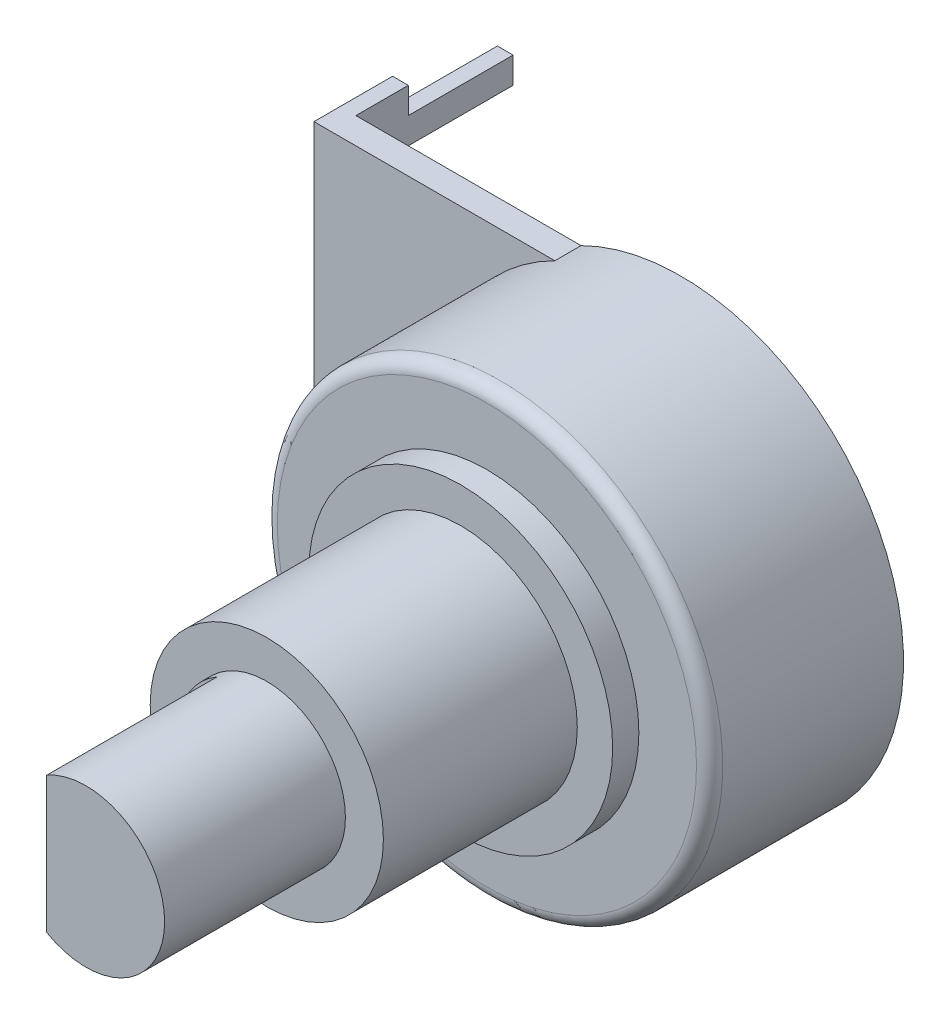
from build123d import *

# Parameters (mm, degrees)
SKETCH_1_R          = 4.45
EXTRUDE_1_DEPTH     = 7.4
SKETCH_2_R          = 3
EXTRUDE_2_DEPTH     = 6.9
SKETCH_3_W          = 3.920658057
SKETCH_3_H          = 6.821702254
CUT_EXTRUDE_1_DEPTH = 6.5
SKETCH_4_R          = 5.8
EXTRUDE_3_DEPTH     = 1
SKETCH_5_R          = 8.5
EXTRUDE_4_DEPTH     = 7.4
FILLET_1_R          = 0.5
SKETCH_6_W          = 13
SKETCH_6_H          = 15.2
EXTRUDE_5_DEPTH     = 1
SKETCH_7_W          = 0.6
SKETCH_7_H          = 3
EXTRUDE_6_DEPTH     = 6
SKETCH_8_W          = 4
SKETCH_8_H          = 1
CUT_EXTRUDE_2_DEPTH = 28.237107042


with BuildPart() as part:
    # Эскиз1 → Бобышка-Вытянуть1 (new body)
    with BuildSketch(Plane.XY):
        Circle(SKETCH_1_R)
    extrude(amount=EXTRUDE_1_DEPTH)

    # Эскиз2 → Бобышка-Вытянуть2 (add)
    with BuildSketch(Plane.XY.offset(7.4)):
        Circle(SKETCH_2_R)
    extrude(amount=EXTRUDE_2_DEPTH)

    # Эскиз3 → Вырез-Вытянуть1 (cut)
    with BuildSketch(Plane.XY.offset(14.3)):
        with Locations((-3.460329029, -0.248834335)):
            Rectangle(SKETCH_3_W, SKETCH_3_H)
    extrude(amount=-CUT_EXTRUDE_1_DEPTH, mode=Mode.SUBTRACT)

    # Эскиз4 → Бобышка-Вытянуть3 (add)
    with BuildSketch(Plane(origin=(0, 0, 0), x_dir=(-1, 0, 0), z_dir=(0, 0, -1))):
        Circle(SKETCH_4_R)
    extrude(amount=EXTRUDE_3_DEPTH)

    # Эскиз5 → Бобышка-Вытянуть4 (add)
    with BuildSketch(Plane(origin=(0, 0, -1), x_dir=(-1, 0, 0), z_dir=(0, 0, -1))):
        Circle(SKETCH_5_R)
    extrude(amount=EXTRUDE_4_DEPTH)

    # Скругление1
    fillet_1_edges = [part.edges().sort_by_distance(p)[0] for p in [
        (8.5, 0, -1),
    ]]
    fillet(fillet_1_edges, radius=FILLET_1_R)

    # Эскиз6 → Бобышка-Вытянуть5 (add)
    with BuildSketch(Plane(origin=(0, 0, -8.4), x_dir=(-1, 0, 0), z_dir=(0, 0, -1))):
        with Locations((6.5, 0)):
            Rectangle(SKETCH_6_W, SKETCH_6_H)
    extrude(amount=-EXTRUDE_5_DEPTH)

    # Эскиз7 → Бобышка-Вытянуть6 (add)
    with BuildSketch(Plane(origin=(0, 0, -8.4), x_dir=(-1, 0, 0), z_dir=(0, 0, -1))):
        with Locations((12.7, 6.1)):
            Rectangle(SKETCH_7_W, SKETCH_7_H)
        with Locations((12.7, 0)):
            Rectangle(SKETCH_7_W, SKETCH_7_H)
        with Locations((12.7, -6.1)):
            Rectangle(SKETCH_7_W, SKETCH_7_H)
    extrude(amount=EXTRUDE_6_DEPTH)

    # Эскиз8 → Вырез-Вытянуть2 (cut, through all)
    with BuildSketch(Plane.ZY.offset(13)):
        with Locations((-12.4, 7.1)):
            Rectangle(SKETCH_8_W, SKETCH_8_H)
        with Locations((-12.4, 5.1)):
            Rectangle(SKETCH_8_W, SKETCH_8_H)
        with Locations((-12.4, 1)):
            Rectangle(SKETCH_8_W, SKETCH_8_H)
        with Locations((-12.4, -1)):
            Rectangle(SKETCH_8_W, SKETCH_8_H)
        with Locations((-12.4, -5.1)):
            Rectangle(SKETCH_8_W, SKETCH_8_H)
        with Locations((-12.4, -7.1)):
            Rectangle(SKETCH_8_W, SKETCH_8_H)
    extrude(amount=-CUT_EXTRUDE_2_DEPTH, mode=Mode.SUBTRACT)


solid = part.part
